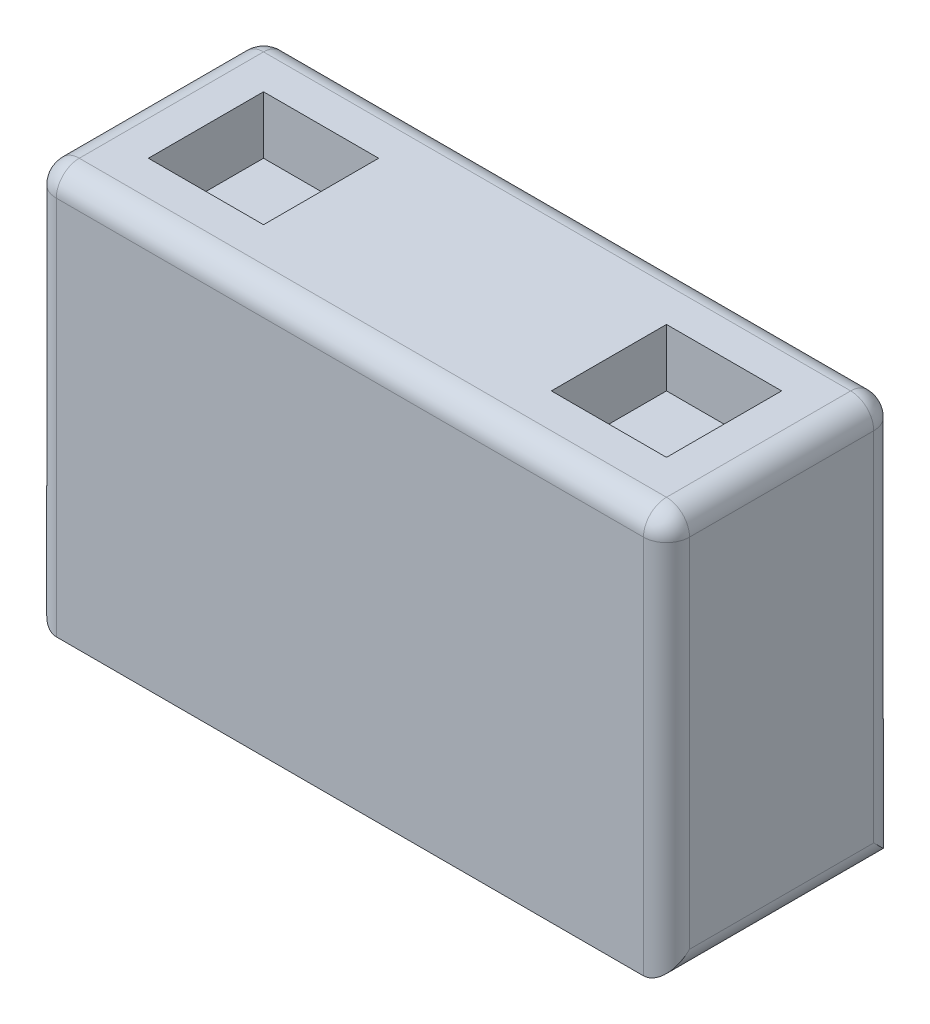
from build123d import *

# Parameters (mm, degrees)
BOSS_EXTRUDE1_DEPTH = 20
SKETCH6_W           = 10
SKETCH6_H           = 10
CUT_EXTRUDE2_DEPTH  = 5
SKETCH7_W           = 10
SKETCH7_H           = 10
CUT_EXTRUDE3_DEPTH  = 5
FILLET1_R           = 2
FILLET2_R           = 2
CUT_EXTRUDE4_DEPTH  = 30
SKETCH9_W           = 43
SKETCH9_H           = 15
CUT_EXTRUDE5_DEPTH  = 25


with BuildPart() as part:
    # Sketch1 → Boss-Extrude1 (new body)
    with BuildSketch(Plane.XY):
        Polygon((-27.5, 32.5), (27.5, 32.5), (27.5, -2.5), (21.5, -2.5), (21.5, -32.5), (-21.5, -32.5), (-21.5, -2.5), (-27.5, -2.5), align=None)
    extrude(amount=BOSS_EXTRUDE1_DEPTH)

    # Sketch6 → Cut-Extrude2 (cut)
    with BuildSketch(Plane(origin=(0, 32.5, 0), x_dir=(1, 0, 0), z_dir=(0, 1, 0))):
        with Locations((-17.5, -10)):
            Rectangle(SKETCH6_W, SKETCH6_H)
        with Locations((17.5, -10)):
            Rectangle(SKETCH6_W, SKETCH6_H)
    extrude(amount=-CUT_EXTRUDE2_DEPTH, mode=Mode.SUBTRACT)

    # Sketch7 → Cut-Extrude3 (cut)
    with BuildSketch(Plane.XZ.offset(32.5)):
        with Locations((-14, 7.5)):
            Rectangle(SKETCH7_W, SKETCH7_H)
        with Locations((14, 7.5)):
            Rectangle(SKETCH7_W, SKETCH7_H)
    extrude(amount=-CUT_EXTRUDE3_DEPTH, mode=Mode.SUBTRACT)

    # Fillet1
    fillet1_edges = [part.edges().sort_by_distance(p)[0] for p in [
        (-21.5, -17.5, 0),
        (-27.5, 15, 0),
        (-27.5, 32.5, 10),
        (27.5, 32.5, 10),
        (27.5, -2.5, 10),
        (-21.5, -32.5, 10),
        (-27.5, -2.5, 10),
        (0, -32.5, 20),
        (21.5, -17.5, 20),
        (27.5, 15, 20),
        (0, 32.5, 20),
        (-27.5, 15, 20),
        (0, 32.5, 0),
        (27.5, 15, 0),
        (21.5, -17.5, 0),
    ]]
    fillet(fillet1_edges, radius=FILLET1_R)

    # Fillet2
    # the kernel refuses this fillet: 2 mm, written as the material it takes off along each edge
    with BuildSketch(Plane(origin=(-19.5, -30.5, 2), x_dir=(0, 0, -1), z_dir=(0, -1, 0))) as fillet2_piece_1_section:
        Polygon((0, 0), (FILLET2_R, 0), (FILLET2_R, -FILLET2_R), (0, -FILLET2_R), align=None)
    fillet2_piece_1 = extrude(amount=FILLET2_R, mode=Mode.PRIVATE)
    fillet2_piece_1 = fillet2_piece_1 - Plane(origin=(-19.5, -30.5, 2), x_dir=(0.7071067811865475, 0, 0.7071067811865475), z_dir=(0, -1, 0)) * Sphere(FILLET2_R, mode=Mode.PRIVATE)
    add(fillet2_piece_1, mode=Mode.SUBTRACT)
    with BuildSketch(Plane(origin=(19.5, -30.5, 18), x_dir=(1, 0, 0), z_dir=(0, -1, 0))) as fillet2_piece_2_section:
        Polygon((0, 0), (FILLET2_R, 0), (FILLET2_R, FILLET2_R), (0, FILLET2_R), align=None)
    fillet2_piece_2 = extrude(amount=FILLET2_R, mode=Mode.PRIVATE)
    fillet2_piece_2 = fillet2_piece_2 - Plane(origin=(19.5, -30.5, 18), x_dir=(-0.7071067811865475, 0, -0.7071067811865475), z_dir=(0, -1, 0)) * Sphere(FILLET2_R, mode=Mode.PRIVATE)
    add(fillet2_piece_2, mode=Mode.SUBTRACT)
    with BuildSketch(Plane(origin=(21.5, -32.5, 2), x_dir=(-1, 0, 0), z_dir=(0, 0, 1))) as fillet2_piece_3:
        with BuildLine():
            CenterArc((FILLET2_R, -FILLET2_R), FILLET2_R, 90, 90)
            Line((0, -FILLET2_R), (0, 0))
            Line((0, 0), (FILLET2_R, 0))
        make_face()
    extrude(amount=16, mode=Mode.SUBTRACT)
    with BuildSketch(Plane(origin=(19.5, -32.5, 0), x_dir=(0, 0, 1), z_dir=(-1, 0, 0))) as fillet2_piece_4:
        with BuildLine():
            CenterArc((FILLET2_R, FILLET2_R), FILLET2_R, 180, 90)
            Line((0, FILLET2_R), (0, 0))
            Line((0, 0), (FILLET2_R, 0))
        make_face()
    extrude(amount=39, mode=Mode.SUBTRACT)
    with BuildSketch(Plane(origin=(19.5, -32.5, 2), x_dir=(0, 0, -1), z_dir=(-1, 0, 0))) as fillet2_piece_5:
        with BuildLine():
            CenterArc((2 - FILLET2_R, -FILLET2_R), FILLET2_R, 360, 90)
            Line((2, -FILLET2_R), (2, 0))
            Line((2, 0), (2 - FILLET2_R, 0))
        make_face()
    revolve(axis=Axis((19.5, -32.5, 2), (0, -1, 0)), revolution_arc=90, mode=Mode.SUBTRACT)

    # Sketch8 → Cut-Extrude4 (cut)
    with BuildSketch(Plane(origin=(0, -2.5, 0), x_dir=(-1, 0, 0), z_dir=(0, -1, 0))):
        Polygon((-23.544279595, 2.278765761), (24.281911255, 2.554989635), (24.437245142, -24.339963353), (-23.544279595, -24.339963353), align=None)
    extrude(amount=CUT_EXTRUDE4_DEPTH, mode=Mode.SUBTRACT)

    # Sketch9 → Cut-Extrude5 (cut)
    with BuildSketch(Plane.XZ.offset(2.5)):
        with Locations((0, 10)):
            Rectangle(SKETCH9_W, SKETCH9_H)
    extrude(amount=-CUT_EXTRUDE5_DEPTH, mode=Mode.SUBTRACT)


solid = part.part
